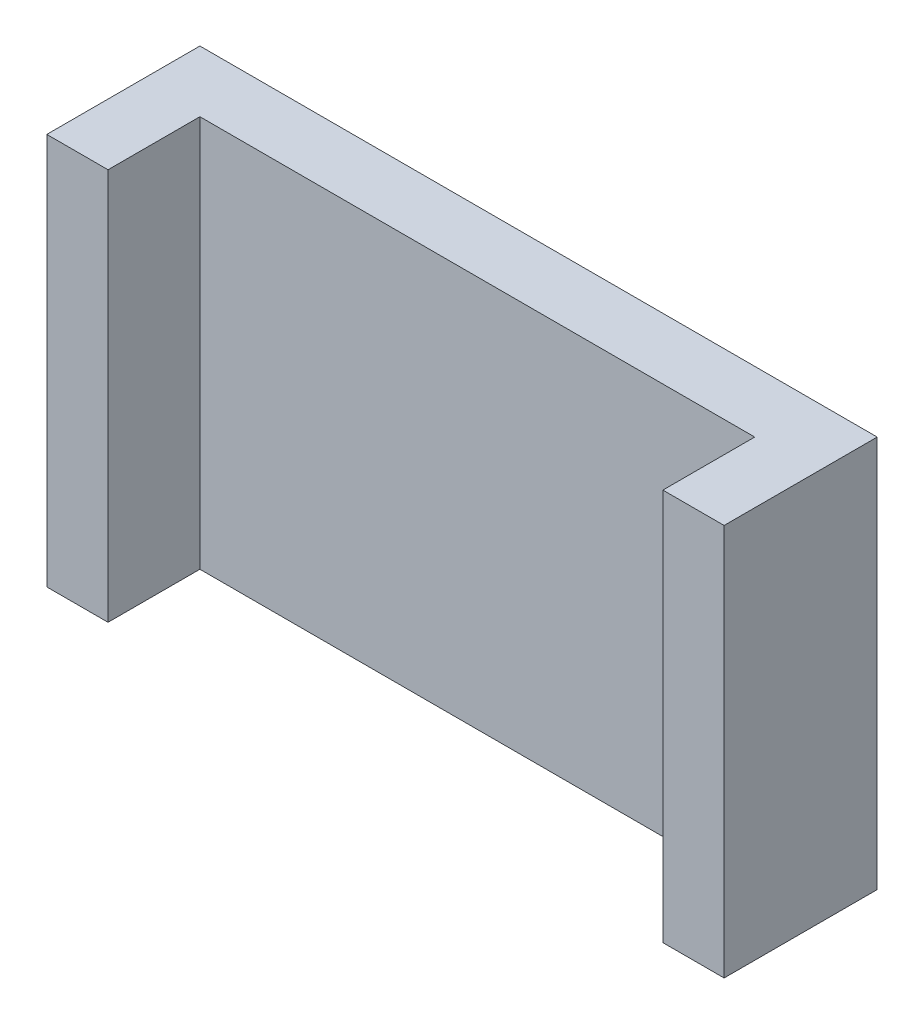
from build123d import *

# Parameters (mm, degrees)
SKETCH1_W           = 55.3
SKETCH1_H           = 32
BOSS_EXTRUDE1_DEPTH = 5
SKETCH2_W           = 5
SKETCH2_H           = 32
BOSS_EXTRUDE2_DEPTH = 7.5


with BuildPart() as part:
    # Sketch1 → Boss-Extrude1 (new body)
    with BuildSketch(Plane.XY):
        with Locations((27.65, 16)):
            Rectangle(SKETCH1_W, SKETCH1_H)
    extrude(amount=BOSS_EXTRUDE1_DEPTH)

    # Sketch2 → Boss-Extrude2 (add)
    with BuildSketch(Plane.XY.offset(5)):
        with Locations((2.5, 16)):
            Rectangle(SKETCH2_W, SKETCH2_H)
        with Locations((52.8, 16)):
            Rectangle(SKETCH2_W, SKETCH2_H)
    extrude(amount=BOSS_EXTRUDE2_DEPTH)


solid = part.part
